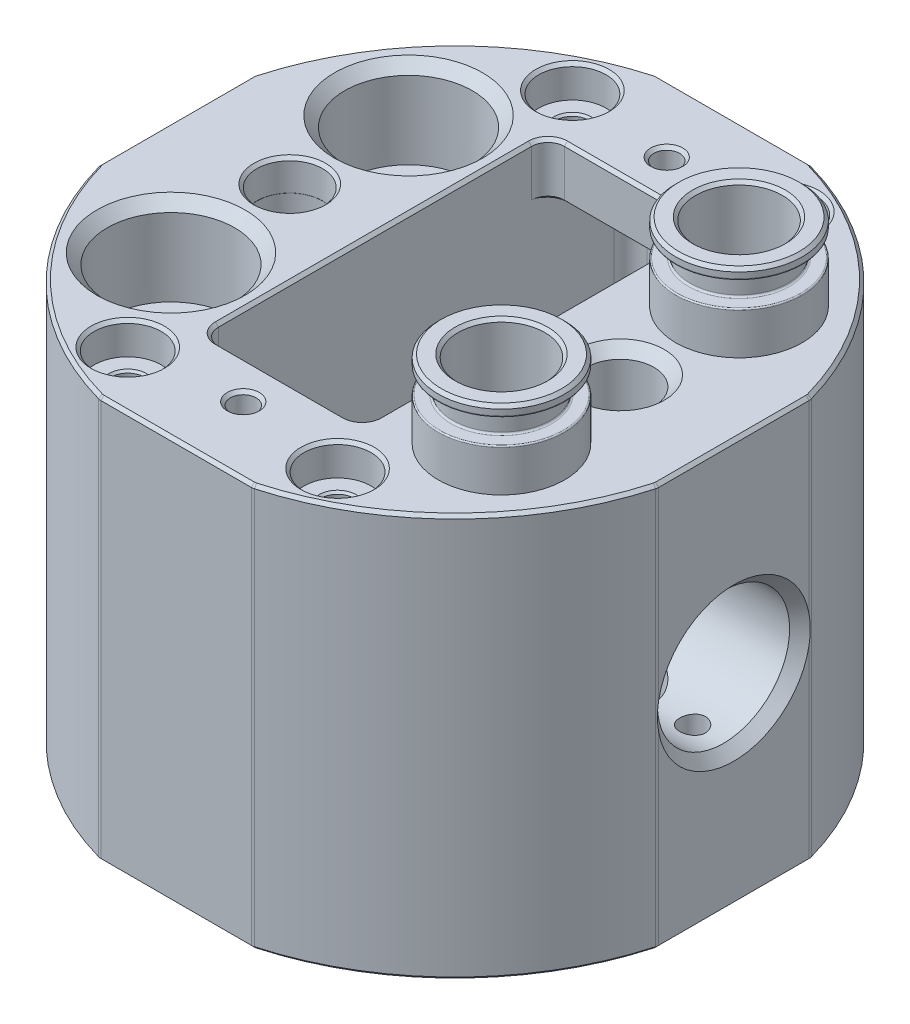
from build123d import *

# Parameters (mm, degrees)
MAIN_FEATURES_R                            = 3.2639
MAIN_FEATURES_R_2                          = 3.16865
BODY_DEPTH                                 = 39
CYLINDER_EDGES_R                           = 1
ELECTRICAL_CUTOUT_DEPTH                    = 33.9
ELECTRICAL_MOUNTING_HOLES_AT_2_COUNT       = 2
ELECTRICAL_MOUNTING_HOLES_AT_2_PITCH       = 41
FLUID_CONNECTOR_SKETCH_W                   = 1.45
FLUID_CONNECTOR_SKETCH_H                   = 8
FLUID_CONNECTOR_SKETCH_W_2                 = 3.225
FLUID_CONNECTOR_SKETCH_H_2                 = 2.15
FLUID_CONNECTOR_SKETCH_W_3                 = 2.6
FLUID_CONNECTOR_SKETCH_H_3                 = 14.5
SCHRADER_RELIEF_SKETCH_R                   = 2.6
SCHRADER_RELIEF_CUT_1_DEPTH                = 13.5
SCHRADER_RELIEF_CUT_2_DEPTH                = 6
O_RING_BORE_CHAMFER_SIZE                   = 1
FLUID_MIRROR_2_COPY_1_SKETCH_W             = 1.45
FLUID_MIRROR_2_COPY_1_SKETCH_H             = 8
FLUID_MIRROR_2_COPY_1_SKETCH_W_2           = 3.225
FLUID_MIRROR_2_COPY_1_SKETCH_H_2           = 2.15
FLUID_MIRROR_2_COPY_1_SKETCH_W_3           = 2.6
FLUID_MIRROR_2_COPY_1_SKETCH_H_3           = 14.5
O_RING_BORE_CHAMFER_OF_FLUID_MIRROR_2_SIZE = 1
LATCH_PIN_SHOULDER_START                   = 36
MAIN_FEATURES_6_R                          = 3.18135
MAIN_FEATURES_6_R_2                        = 3.16865
LATCH_PIN_SHOULDER_DEPTH                   = 3
MOUNTING_HOLES_AT_2_COUNT                  = 2
MOUNTING_HOLES_AT_2_PITCH                  = 20.318917454
MOUNTING_HOLES_AT_3_COUNT                  = 2
MOUNTING_HOLES_AT_3_PITCH                  = 43.058820532
MOUNTING_HOLES_AT_4_COUNT                  = 2
MOUNTING_HOLES_AT_4_PITCH                  = 47.612187853
LATCH_2_SKETCH_7_R                         = 6.4008
RELEASE_BUTTON_BORE_DEPTH                  = 17.75
LATCH_PIN_CHAMFER_SIZE                     = 1
BREAK_EDGES_SIZE                           = 0.3


with BuildPart() as part:
    # main_features → body (new body)
    with BuildSketch(Plane(origin=(0, 0, 0), x_dir=(1, 0, 0), z_dir=(0, 1, 0))):
        with BuildLine():
            Line((-27, 7.416198487), (-27, -7.416198487))
            ThreePointArc((-27, -7.416198487), (-19.798989873, -19.798989873), (-7.416198487, -27))
            Line((-7.416198487, -27), (7.416198487, -27))
            ThreePointArc((7.416198487, -27), (19.798989873, -19.798989873), (27, -7.416198487))
            Line((27, -7.416198487), (27, 7.416198487))
            ThreePointArc((27, 7.416198487), (19.798989873, 19.798989873), (7.416198487, 27))
            Line((7.416198487, 27), (-7.416198487, 27))
            ThreePointArc((-7.416198487, 27), (-19.798989873, 19.798989873), (-27, 7.416198487))
        make_face()
        with BuildLine():
            Line((-6.1625, 16.75), (6.1625, 16.75))
            ThreePointArc((6.1625, 16.75), (7.285032015, 16.285032015), (7.75, 15.1625))
            Line((7.75, 15.1625), (7.75, -15.1625))
            ThreePointArc((7.75, -15.1625), (7.285032015, -16.285032015), (6.1625, -16.75))
            Line((6.1625, -16.75), (-6.1625, -16.75))
            ThreePointArc((-6.1625, -16.75), (-7.285032015, -16.285032015), (-7.75, -15.1625))
            Line((-7.75, -15.1625), (-7.75, 15.1625))
            ThreePointArc((-7.75, 15.1625), (-7.285032015, 16.285032015), (-6.1625, 16.75))
        make_face(mode=Mode.SUBTRACT)
        with Locations(Location((16, 0, 0), (0, 0, 270))):
            Circle(MAIN_FEATURES_R, mode=Mode.SUBTRACT)
        with Locations(Location((-16, 0, 0), (0, 0, 270))):
            Circle(MAIN_FEATURES_R_2, mode=Mode.SUBTRACT)
    extrude(amount=BODY_DEPTH)

    # cylinder_edges
    cylinder_edges_edges = [part.edges().sort_by_distance(p)[0] for p in [
        (-7.416198487, 19.5, 27),
        (-27, 19.5, 7.416198487),
        (-27, 19.5, -7.416198487),
        (-7.416198487, 19.5, -27),
        (7.416198487, 19.5, -27),
        (27, 19.5, -7.416198487),
        (27, 19.5, 7.416198487),
        (7.416198487, 19.5, 27),
    ]]
    fillet(cylinder_edges_edges, radius=CYLINDER_EDGES_R)

    # Sketch1<3> → electrical_cutout (cut)
    with BuildSketch(Plane(origin=(0, 0, 0), x_dir=(1, 0, 0), z_dir=(0, 1, 0))):
        with BuildLine():
            Line((-6.1625, 16.75), (6.1625, 16.75))
            ThreePointArc((6.1625, 16.75), (7.285032015, 16.285032015), (7.75, 15.1625))
            Line((7.75, 15.1625), (7.75, 23.1625))
            ThreePointArc((7.75, 23.1625), (7.285032015, 24.285032015), (6.1625, 24.75))
            Line((6.1625, 24.75), (-6.1625, 24.75))
            ThreePointArc((-6.1625, 24.75), (-7.285032015, 24.285032015), (-7.75, 23.1625))
            Line((-7.75, 23.1625), (-7.75, 15.1625))
            ThreePointArc((-7.75, 15.1625), (-7.285032015, 16.285032015), (-6.1625, 16.75))
        make_face()
        with BuildLine():
            Line((7.75, -23.1625), (7.75, -15.1625))
            ThreePointArc((7.75, -15.1625), (7.285032015, -16.285032015), (6.1625, -16.75))
            Line((6.1625, -16.75), (-6.1625, -16.75))
            ThreePointArc((-6.1625, -16.75), (-7.285032015, -16.285032015), (-7.75, -15.1625))
            Line((-7.75, -15.1625), (-7.75, -23.1625))
            ThreePointArc((-7.75, -23.1625), (-7.285032015, -24.285032015), (-6.1625, -24.75))
            Line((-6.1625, -24.75), (6.1625, -24.75))
            ThreePointArc((6.1625, -24.75), (7.285032015, -24.285032015), (7.75, -23.1625))
        make_face()
    extrude(amount=ELECTRICAL_CUTOUT_DEPTH, mode=Mode.SUBTRACT)

    # Sketch9 → electrical_mounting_holes (revolve, cut)
    with BuildSketch(Plane(origin=(0, 33.9, 20.5), x_dir=(0, 0, -1), z_dir=(1, 0, 0))):
        Polygon((0, 0), (0, 5.1), (1.55, 5.1), (1.25, 4.8), (1.25, 0), align=None)
    electrical_mounting_holes = revolve(axis=Axis((0, 27.55, 20.5), (0, 1, 0)), mode=Mode.SUBTRACT)

    # electrical_mounting_holes at 2: electrical_mounting_holes ×2
    with Locations(*[(0, 0, -i * ELECTRICAL_MOUNTING_HOLES_AT_2_PITCH) for i in range(1, ELECTRICAL_MOUNTING_HOLES_AT_2_COUNT)]):
        add(electrical_mounting_holes, mode=Mode.SUBTRACT)

    # fluid_connector_sketch → fluid_connector_cutout (revolve, cut)
    with BuildSketch(Plane.XY.offset(11.5), mode=Mode.PRIVATE) as fluid_connector_cutout_sk:
        Polygon((10.7, 0), (11.325, 0), (11.325, 8), (10.7, 8), (10.7, 0.3), align=None)
        with Locations((12.05, 4)):
            Rectangle(FLUID_CONNECTOR_SKETCH_W, FLUID_CONNECTOR_SKETCH_H)
        with Locations((14.3875, 4)):
            Rectangle(FLUID_CONNECTOR_SKETCH_W_2, FLUID_CONNECTOR_SKETCH_H)
        with BuildLine():
            Line((11.325, 8), (12.775, 8))
            Line((12.775, 8), (12.775, 10.15))
            Line((12.775, 10.15), (11.426933921, 10.15))
            ThreePointArc((11.426933921, 10.15), (11.352354097, 10.076655003), (11.325, 9.975692674))
            Line((11.325, 9.975692674), (11.325, 8))
        make_face()
        with Locations((14.3875, 9.075)):
            Rectangle(FLUID_CONNECTOR_SKETCH_W_2, FLUID_CONNECTOR_SKETCH_H_2)
        with BuildLine():
            Line((11.426933921, 10.15), (12.775, 10.15))
            Line((12.775, 10.15), (12.775, 10.35))
            Line((12.775, 10.35), (11.497672521, 10.173816899))
            ThreePointArc((11.497672521, 10.173816899), (11.461182312, 10.165237662), (11.426933921, 10.15))
        make_face()
        Polygon((12.775, 10.15), (16, 10.15), (16, 12.5), (13.4, 12.5), (12.875, 12.5), (12.775, 11.5), (12.775, 10.35), align=None)
        with Locations((14.7, 19.75)):
            Rectangle(FLUID_CONNECTOR_SKETCH_W_3, FLUID_CONNECTOR_SKETCH_H_3)
        Polygon((13.4, 27), (16, 27), (16, 35), (12.5, 35), (12.5, 27), align=None)
        Polygon((12.5, 35), (16, 35), (16, 39), (11.8, 39), (11.8, 35), align=None)
        Polygon((10.4, 0), (10.7, 0), (10.7, 0.3), align=None)
    fluid_connector_cutout = revolve(fluid_connector_cutout_sk.sketch.rotate(Axis((16, 0, 11.5), (0, 1, 0)), 270), axis=Axis((16, 0, 11.5), (0, 1, 0)), mode=Mode.SUBTRACT)

    # fluid_connector_sketch<4> → o-ring_boss (revolve)
    with BuildSketch(Plane.XY.offset(11.5), mode=Mode.PRIVATE) as o_ring_boss_sk:
        with BuildLine():
            Line((20.2, 46.5), (20.2, 39))
            Line((20.2, 39), (22.1214, 39))
            Line((22.1214, 39), (22.1214, 42.9854))
            ThreePointArc((22.1214, 42.9854), (22.084202561, 43.075202561), (21.9944, 43.1124))
            Line((21.9944, 43.1124), (20.9022, 43.1124))
            ThreePointArc((20.9022, 43.1124), (20.776476414, 43.164476414), (20.7244, 43.2902))
            Line((20.7244, 43.2902), (20.7244, 45.3222))
            ThreePointArc((20.7244, 45.3222), (20.776476414, 45.447923586), (20.9022, 45.5))
            Line((20.9022, 45.5), (21.9944, 45.5))
            ThreePointArc((21.9944, 45.5), (22.084202561, 45.537197439), (22.1214, 45.627))
            Line((22.1214, 45.627), (22.1214, 46.5))
            Line((22.1214, 46.5), (20.2, 46.5))
        make_face()
        with BuildLine():
            Line((9.8786, 39), (11.8, 39))
            Line((11.8, 39), (11.8, 46.5))
            Line((11.8, 46.5), (9.8786, 46.5))
            Line((9.8786, 46.5), (9.8786, 45.627))
            ThreePointArc((9.8786, 45.627), (9.915797439, 45.537197439), (10.0056, 45.5))
            Line((10.0056, 45.5), (11.0978, 45.5))
            ThreePointArc((11.0978, 45.5), (11.223523586, 45.447923586), (11.2756, 45.3222))
            Line((11.2756, 45.3222), (11.2756, 43.2902))
            ThreePointArc((11.2756, 43.2902), (11.223523586, 43.164476414), (11.0978, 43.1124))
            Line((11.0978, 43.1124), (10.0056, 43.1124))
            ThreePointArc((10.0056, 43.1124), (9.915797439, 43.075202561), (9.8786, 42.9854))
            Line((9.8786, 42.9854), (9.8786, 39))
        make_face()
    o_ring_boss = revolve(o_ring_boss_sk.sketch.rotate(Axis((16, 0, 11.5), (0, 1, 0)), 90), axis=Axis((16, 0, 11.5), (0, 1, 0)))

    # fluid_connector_sketch<6> one side → o-ring_bore (revolve, cut)
    with BuildSketch(Plane.XY.offset(11.5), mode=Mode.PRIVATE) as o_ring_bore_sk:
        Polygon((-19.5, 27.5), (-19.5, 19.5), (-16, 19.5), (-16, 39), (-22.1722, 39), (-22.1722, 30.5), (-20.2, 30.5), (-20.2, 27.5), align=None)
    o_ring_bore = revolve(o_ring_bore_sk.sketch.rotate(Axis((-16, 0, 11.5), (0, 1, 0)), 180), axis=Axis((-16, 0, 11.5), (0, 1, 0)), mode=Mode.SUBTRACT)

    # fluid_mirror_1: fluid_connector_cutout across plane
    add(fluid_connector_cutout.mirror(Plane(origin=(0, 0, 0), x_dir=(0, 0, 1), z_dir=(1, 0, 0))), mode=Mode.SUBTRACT)

    # schrader_relief_sketch → schrader_relief_cut_1 (cut)
    with BuildSketch(Plane.XZ.offset(-12.5)):
        with BuildLine():
            ThreePointArc((18.992702522, 10.600357508), (19.091748727, 11.045340997), (19.125, 11.5))
            ThreePointArc((19.125, 11.5), (19.091748727, 11.954659003), (18.992702522, 12.399642492))
            ThreePointArc((18.992702522, 12.399642492), (18.375189631, 13.325183005), (17.345995177, 13.747919554))
            ThreePointArc((17.345995177, 13.747919554), (17.305320374, 13.760881283), (17.273757807, 13.789625855))
            ThreePointArc((17.273757807, 13.789625855), (16.393059998, 14.469566075), (15.282761992, 14.541577656))
            ThreePointArc((15.282761992, 14.541577656), (14.4375, 14.206329387), (13.724535486, 13.641935164))
            ThreePointArc((13.724535486, 13.641935164), (13.231750336, 12.644383056), (13.380246972, 11.54170624))
            ThreePointArc((13.380246972, 11.54170624), (13.389359187, 11.499999962), (13.380246941, 11.458293691))
            ThreePointArc((13.380246941, 11.458293691), (13.231750342, 10.355616906), (13.724535486, 9.358064836))
            ThreePointArc((13.724535486, 9.358064836), (14.4375, 8.793670613), (15.282761992, 8.458422344))
            ThreePointArc((15.282761992, 8.458422344), (16.393060034, 8.530433939), (17.27375785, 9.210374206))
            ThreePointArc((17.27375785, 9.210374206), (17.305320439, 9.239118754), (17.345995252, 9.252080453))
            ThreePointArc((17.345995252, 9.252080453), (18.37518966, 9.674817019), (18.992702522, 10.600357508))
        make_face()
        with Locations(Location((16, 11.5, 0), (0, 0, 270))):
            Circle(SCHRADER_RELIEF_SKETCH_R, mode=Mode.SUBTRACT)
    schrader_relief_cut_1 = extrude(amount=-SCHRADER_RELIEF_CUT_1_DEPTH, mode=Mode.SUBTRACT)

    # schrader_relief_sketch<4> → schrader_relief_cut_2 (cut)
    with BuildSketch(Plane.XZ.offset(-12.5)):
        with BuildLine():
            ThreePointArc((-15.282761992, 14.541577656), (-16.393059998, 14.469566075), (-17.273757807, 13.789625855))
            ThreePointArc((-17.273757807, 13.789625855), (-17.305320374, 13.760881283), (-17.345995177, 13.747919554))
            ThreePointArc((-17.345995177, 13.747919554), (-18.375189631, 13.325183005), (-18.992702522, 12.399642492))
            ThreePointArc((-18.992702522, 12.399642492), (-19.125, 11.5), (-18.992702522, 10.600357508))
            ThreePointArc((-18.992702522, 10.600357508), (-18.37518966, 9.674817019), (-17.345995252, 9.252080453))
            ThreePointArc((-17.345995252, 9.252080453), (-17.305320439, 9.239118754), (-17.27375785, 9.210374206))
            ThreePointArc((-17.27375785, 9.210374206), (-16.393060034, 8.530433939), (-15.282761992, 8.458422344))
            ThreePointArc((-15.282761992, 8.458422344), (-14.4375, 8.793670613), (-13.724535486, 9.358064836))
            ThreePointArc((-13.724535486, 9.358064836), (-13.231750342, 10.355616906), (-13.380246941, 11.458293691))
            ThreePointArc((-13.380246941, 11.458293691), (-13.389359187, 11.499999962), (-13.380246972, 11.54170624))
            ThreePointArc((-13.380246972, 11.54170624), (-13.231750336, 12.644383056), (-13.724535486, 13.641935164))
            ThreePointArc((-13.724535486, 13.641935164), (-14.4375, 14.206329387), (-15.282761992, 14.541577656))
        make_face()
    schrader_relief_cut_2 = extrude(amount=-SCHRADER_RELIEF_CUT_2_DEPTH, mode=Mode.SUBTRACT)

    # o-ring_bore_chamfer
    o_ring_bore_chamfer_edges = [part.edges().sort_by_distance(p)[0] for p in [
        (-22.1722, 39, 11.5),
    ]]
    chamfer(o_ring_bore_chamfer_edges, length=O_RING_BORE_CHAMFER_SIZE)

    # fluid_mirror_2: fluid_connector_cutout, o-ring_boss, o-ring_bore, schrader_relief_cut_1, schrader_relief_cut_2 across plane
    add(fluid_connector_cutout.mirror(Plane.XY), mode=Mode.SUBTRACT)
    add(o_ring_boss.mirror(Plane.XY))
    add(o_ring_bore.mirror(Plane.XY), mode=Mode.SUBTRACT)
    add(schrader_relief_cut_1.mirror(Plane.XY), mode=Mode.SUBTRACT)
    add(schrader_relief_cut_2.mirror(Plane.XY), mode=Mode.SUBTRACT)

    # fluid_mirror_2 copy 1 sketch → fluid_mirror_2 copy 1 (revolve, cut)
    with BuildSketch(Plane(origin=(0, 0, -11.5), x_dir=(-1, 0, 0), z_dir=(0, 0, -1))):
        Polygon((10.7, 0), (11.325, 0), (11.325, 8), (10.7, 8), (10.7, 0.3), align=None)
        with Locations((12.05, 4)):
            Rectangle(FLUID_MIRROR_2_COPY_1_SKETCH_W, FLUID_MIRROR_2_COPY_1_SKETCH_H)
        with Locations((14.3875, 4)):
            Rectangle(FLUID_MIRROR_2_COPY_1_SKETCH_W_2, FLUID_MIRROR_2_COPY_1_SKETCH_H)
        with BuildLine():
            Line((11.325, 8), (12.775, 8))
            Line((12.775, 8), (12.775, 10.15))
            Line((12.775, 10.15), (11.426933921, 10.15))
            ThreePointArc((11.426933921, 10.15), (11.352354097, 10.076655003), (11.325, 9.975692674))
            Line((11.325, 9.975692674), (11.325, 8))
        make_face()
        with Locations((14.3875, 9.075)):
            Rectangle(FLUID_MIRROR_2_COPY_1_SKETCH_W_2, FLUID_MIRROR_2_COPY_1_SKETCH_H_2)
        with BuildLine():
            Line((11.426933921, 10.15), (12.775, 10.15))
            Line((12.775, 10.15), (12.775, 10.35))
            Line((12.775, 10.35), (11.497672521, 10.173816899))
            ThreePointArc((11.497672521, 10.173816899), (11.461182312, 10.165237662), (11.426933921, 10.15))
        make_face()
        Polygon((12.775, 10.15), (16, 10.15), (16, 12.5), (13.4, 12.5), (12.875, 12.5), (12.775, 11.5), (12.775, 10.35), align=None)
        with Locations((14.7, 19.75)):
            Rectangle(FLUID_MIRROR_2_COPY_1_SKETCH_W_3, FLUID_MIRROR_2_COPY_1_SKETCH_H_3)
        Polygon((13.4, 27), (16, 27), (16, 35), (12.5, 35), (12.5, 27), align=None)
        Polygon((12.5, 35), (16, 35), (16, 39), (11.8, 39), (11.8, 35), align=None)
        Polygon((10.4, 0), (10.7, 0), (10.7, 0.3), align=None)
    revolve(axis=Axis((-16, 0, -11.5), (0, 1, 0)), mode=Mode.SUBTRACT)

    # o-ring_bore_chamfer of fluid_mirror_2
    o_ring_bore_chamfer_of_fluid_mirror_2_edges = [part.edges().sort_by_distance(p)[0] for p in [
        (-22.1722, 39, -11.5),
    ]]
    chamfer(o_ring_bore_chamfer_of_fluid_mirror_2_edges, length=O_RING_BORE_CHAMFER_OF_FLUID_MIRROR_2_SIZE)

    # main_features<6> → latch_pin_shoulder (cut)
    with BuildSketch(Plane(origin=(0, 0, 0), x_dir=(1, 0, 0), z_dir=(0, 1, 0)).offset(LATCH_PIN_SHOULDER_START)):
        with Locations(Location((-16, 0, 0), (0, 0, 270))):
            Circle(MAIN_FEATURES_6_R)
        with Locations(Location((-16, 0, 0), (0, 0, 270))):
            Circle(MAIN_FEATURES_6_R_2, mode=Mode.SUBTRACT)
    extrude(amount=LATCH_PIN_SHOULDER_DEPTH, mode=Mode.SUBTRACT)

    # Sketch11 → mounting_holes (revolve, cut)
    with BuildSketch(Plane(origin=(10.159458727, 39, 21.529410266), x_dir=(0, 0, 1), z_dir=(1, 0, 0))):
        Polygon((0, 0), (0, 39), (1.8, 39), (1.6, 38.8), (1.6, 3.3), (1.8, 3.1), (3.25, 3.1), (3.25, 0), align=None)
    mounting_holes = revolve(axis=Axis((10.159458727, 45.35, 21.529410266), (0, -1, 0)), mode=Mode.SUBTRACT)

    # mounting_holes at 2: mounting_holes ×2
    with Locations(*[(-i * MOUNTING_HOLES_AT_2_PITCH, 0, 0) for i in range(1, MOUNTING_HOLES_AT_2_COUNT)]):
        add(mounting_holes, mode=Mode.SUBTRACT)

    # mounting_holes at 3: mounting_holes ×2
    with Locations(*[(0, 0, -i * MOUNTING_HOLES_AT_3_PITCH) for i in range(1, MOUNTING_HOLES_AT_3_COUNT)]):
        add(mounting_holes, mode=Mode.SUBTRACT)

    # mounting_holes at 4: mounting_holes ×2
    with Locations(*[Vector(-0.4267587433148433, 0, -0.9043655096277919) * (i * MOUNTING_HOLES_AT_4_PITCH) for i in range(1, MOUNTING_HOLES_AT_4_COUNT)]):
        add(mounting_holes, mode=Mode.SUBTRACT)

    # latch_2_sketch<7> → release_button_bore (cut)
    with BuildSketch(Plane(origin=(27, 0, 32), x_dir=(0, 0, 1), z_dir=(-1, 0, 0))):
        with Locations(Location((-32, 19.5, 0), (0, 0, 180))):
            Circle(LATCH_2_SKETCH_7_R)
    extrude(amount=RELEASE_BUTTON_BORE_DEPTH, mode=Mode.SUBTRACT)

    # set_screw_hole: read off the stored shape, not the designer's step
    # set_screw_hole outline → set_screw_hole (revolve, cut)
    with BuildSketch(Plane(origin=(23, 0, 0), x_dir=(1, 0, 0), z_dir=(0, 0, 1))):
        Polygon((1.25, 0.5), (1.25, 13.222509506), (0, 13.222509506), (0, 0), (1.75, 0), align=None)
    revolve(axis=Axis((23, 0, 0), (0, 1, 0)), mode=Mode.SUBTRACT)

    # latch_pin_chamfer
    # the kernel refuses this chamfer: 1 mm, written as the material it takes off along each edge
    with BuildSketch(Plane(origin=(16, 39, 0), x_dir=(0, 0, 1), z_dir=(-1, 0, 0))) as latch_pin_chamfer_piece_1:
        Polygon((3.2639 + LATCH_PIN_CHAMFER_SIZE, 0), (3.2639, -LATCH_PIN_CHAMFER_SIZE), (3.2639, 0), align=None)
    revolve(axis=Axis((16, 39, 0), (0, 1, 0)), mode=Mode.SUBTRACT)
    with BuildSketch(Plane(origin=(27, 19.5, 0), x_dir=(0, 0, -1), z_dir=(0, 1, 0))) as latch_pin_chamfer_piece_2:
        Polygon((6.4008 + LATCH_PIN_CHAMFER_SIZE, 0), (6.4008, LATCH_PIN_CHAMFER_SIZE), (6.4008, 0), align=None)
    revolve(axis=Axis((27, 19.5, 0), (-1, 0, 0)), mode=Mode.SUBTRACT)

    # break_edges
    # the kernel refuses this chamfer: 0.3 mm, written as the material it takes off along each edge
    with BuildSketch(Plane(origin=(7.75, 39, -15.1625), x_dir=(1, 0, 0), z_dir=(0, 0, 1)), Plane(origin=(-7.75, 39, 15.1625), x_dir=(-1, 0, 0), z_dir=(0, 0, -1))) as break_edges_piece_1:
        Polygon((BREAK_EDGES_SIZE, 0), (0, -BREAK_EDGES_SIZE), (0, 0), align=None)
    extrude(amount=30.325, mode=Mode.SUBTRACT)
    with BuildSketch(Plane(origin=(6.1625, 33.9, -15.1625), x_dir=(0, 0, -1), z_dir=(-1, 0, 0))) as break_edges_piece_2_section:
        Polygon((1.5875, -BREAK_EDGES_SIZE), (1.5875 + BREAK_EDGES_SIZE, 0), (1.5875, 0), align=None)
    break_edges_piece_2 = revolve(axis=Axis((6.1625, 33.9, -15.1625), (0, -1, 0)), revolution_arc=137.355555028, mode=Mode.PRIVATE)
    break_edges_piece_2 = split(break_edges_piece_2, bisect_by=Plane(origin=(7.75, 33.9, -15.1625), z_dir=(-1, 0, 0)), keep=Keep.TOP, mode=Mode.PRIVATE)
    add(break_edges_piece_2, mode=Mode.SUBTRACT)
    with BuildSketch(Plane(origin=(6.1625, 0, -24.75), x_dir=(0, 0, -1), z_dir=(-1, 0, 0)), Plane(origin=(-6.1625, 33.9, -16.75), x_dir=(0, 1, 0), z_dir=(1, 0, 0)), Plane(origin=(-6.1625, 0, 24.75), x_dir=(0, 0, 1), z_dir=(1, 0, 0)), Plane(origin=(6.1625, 33.9, 16.75), x_dir=(0, 1, 0), z_dir=(-1, 0, 0)), Plane(origin=(6.1625, 39, 16.75), x_dir=(0, 0, 1), z_dir=(-1, 0, 0)), Plane(origin=(-6.1625, 39, -16.75), x_dir=(0, 0, -1), z_dir=(1, 0, 0))) as break_edges_piece_3:
        Polygon((BREAK_EDGES_SIZE, 0), (0, -BREAK_EDGES_SIZE), (0, 0), align=None)
    extrude(amount=12.325, mode=Mode.SUBTRACT)
    with BuildSketch(Plane(origin=(6.1625, 0, -23.1625), x_dir=(1, 0, 0), z_dir=(0, 0, 1))) as break_edges_piece_4:
        Polygon((1.5875 + BREAK_EDGES_SIZE, 0), (1.5875, BREAK_EDGES_SIZE), (1.5875, 0), align=None)
    revolve(axis=Axis((6.1625, 0, -23.1625), (0, 1, 0)), revolution_arc=90, mode=Mode.SUBTRACT)
    with BuildSketch(Plane(origin=(-6.1625, 33.9, -15.1625), x_dir=(-0.6774467646526394, 0, 0.7355718055102924), z_dir=(0.7355718055102924, 0, 0.6774467646526394))) as break_edges_piece_5_section:
        Polygon((1.5875, -BREAK_EDGES_SIZE), (1.5875 + BREAK_EDGES_SIZE, 0), (1.5875, 0), align=None)
    break_edges_piece_5 = revolve(axis=Axis((-6.1625, 33.9, -15.1625), (0, -1, 0)), revolution_arc=137.355555028, mode=Mode.PRIVATE)
    break_edges_piece_5 = split(break_edges_piece_5, bisect_by=Plane(origin=(-7.75, 33.9, -15.1625), z_dir=(1, 0, 0)), keep=Keep.TOP, mode=Mode.PRIVATE)
    add(break_edges_piece_5, mode=Mode.SUBTRACT)
    with BuildSketch(Plane(origin=(-6.1625, 0, -23.1625), x_dir=(0, 0, -1), z_dir=(1, 0, 0))) as break_edges_piece_6:
        Polygon((1.5875 + BREAK_EDGES_SIZE, 0), (1.5875, BREAK_EDGES_SIZE), (1.5875, 0), align=None)
    revolve(axis=Axis((-6.1625, 0, -23.1625), (0, 1, 0)), revolution_arc=90, mode=Mode.SUBTRACT)
    with BuildSketch(Plane(origin=(6.1625, 0, 23.1625), x_dir=(0, 0, 1), z_dir=(-1, 0, 0))) as break_edges_piece_7:
        Polygon((1.5875 + BREAK_EDGES_SIZE, 0), (1.5875, BREAK_EDGES_SIZE), (1.5875, 0), align=None)
    revolve(axis=Axis((6.1625, 0, 23.1625), (0, 1, 0)), revolution_arc=90, mode=Mode.SUBTRACT)
    with BuildSketch(Plane(origin=(-6.1625, 0, 23.1625), x_dir=(-1, 0, 0), z_dir=(0, 0, -1))) as break_edges_piece_8:
        Polygon((1.5875 + BREAK_EDGES_SIZE, 0), (1.5875, BREAK_EDGES_SIZE), (1.5875, 0), align=None)
    revolve(axis=Axis((-6.1625, 0, 23.1625), (0, 1, 0)), revolution_arc=90, mode=Mode.SUBTRACT)
    with BuildSketch(Plane(origin=(6.1625, 33.9, 15.1625), x_dir=(0.6774467646526388, 0, -0.7355718055102929), z_dir=(-0.7355718055102929, 0, -0.6774467646526388))) as break_edges_piece_9_section:
        Polygon((1.5875, -BREAK_EDGES_SIZE), (1.5875 + BREAK_EDGES_SIZE, 0), (1.5875, 0), align=None)
    break_edges_piece_9 = revolve(axis=Axis((6.1625, 33.9, 15.1625), (0, -1, 0)), revolution_arc=137.355555028, mode=Mode.PRIVATE)
    break_edges_piece_9 = split(break_edges_piece_9, bisect_by=Plane(origin=(7.75, 33.9, 15.1625), z_dir=(-1, 0, 0)), keep=Keep.TOP, mode=Mode.PRIVATE)
    add(break_edges_piece_9, mode=Mode.SUBTRACT)
    with BuildSketch(Plane(origin=(-6.1625, 33.9, 15.1625), x_dir=(0, 0, 1), z_dir=(1, 0, 0))) as break_edges_piece_10_section:
        Polygon((1.5875, -BREAK_EDGES_SIZE), (1.5875 + BREAK_EDGES_SIZE, 0), (1.5875, 0), align=None)
    break_edges_piece_10 = revolve(axis=Axis((-6.1625, 33.9, 15.1625), (0, -1, 0)), revolution_arc=137.355555028, mode=Mode.PRIVATE)
    break_edges_piece_10 = split(break_edges_piece_10, bisect_by=Plane(origin=(-7.75, 33.9, 15.1625), z_dir=(1, 0, 0)), keep=Keep.TOP, mode=Mode.PRIVATE)
    add(break_edges_piece_10, mode=Mode.SUBTRACT)
    with BuildSketch(Plane(origin=(6.1625, 39, 15.1625), x_dir=(1, 0, 0), z_dir=(0, 0, -1))) as break_edges_piece_11:
        Polygon((1.5875 + BREAK_EDGES_SIZE, 0), (1.5875, BREAK_EDGES_SIZE), (1.5875, 0), align=None)
    revolve(axis=Axis((6.1625, 39, 15.1625), (0, -1, 0)), revolution_arc=90, mode=Mode.SUBTRACT)
    with BuildSketch(Plane(origin=(-16, 0, 0), x_dir=(0, 0, 1), z_dir=(-1, 0, 0))) as break_edges_piece_12:
        Polygon((3.16865 + BREAK_EDGES_SIZE, 0), (3.16865, BREAK_EDGES_SIZE), (3.16865, 0), align=None)
    revolve(axis=Axis((-16, 0, 0), (0, 1, 0)), mode=Mode.SUBTRACT)
    with BuildSketch(Plane(origin=(16, 46.5, 11.5), x_dir=(0, 0, -1), z_dir=(1, 0, 0))) as break_edges_piece_13:
        Polygon((4.2 + BREAK_EDGES_SIZE, 0), (4.2, -BREAK_EDGES_SIZE), (4.2, 0), align=None)
    revolve(axis=Axis((16, 46.5, 11.5), (0, 1, 0)), mode=Mode.SUBTRACT)
    with BuildSketch(Plane(origin=(16, 46.5, 11.5), x_dir=(0, 0, -1), z_dir=(1, 0, 0))) as break_edges_piece_14:
        Polygon((6.1214, -BREAK_EDGES_SIZE), (6.1214 - BREAK_EDGES_SIZE, 0), (6.1214, 0), align=None)
    revolve(axis=Axis((16, 46.5, 11.5), (0, 1, 0)), mode=Mode.SUBTRACT)
    with BuildSketch(Plane(origin=(16, 0, 0), x_dir=(0, 0, 1), z_dir=(-1, 0, 0))) as break_edges_piece_15:
        Polygon((3.2639 + BREAK_EDGES_SIZE, 0), (3.2639, BREAK_EDGES_SIZE), (3.2639, 0), align=None)
    revolve(axis=Axis((16, 0, 0), (0, 1, 0)), mode=Mode.SUBTRACT)
    with BuildSketch(Plane(origin=(-6.1625, 39, 15.1625), x_dir=(0, 0, 1), z_dir=(1, 0, 0))) as break_edges_piece_16:
        Polygon((1.5875 + BREAK_EDGES_SIZE, 0), (1.5875, BREAK_EDGES_SIZE), (1.5875, 0), align=None)
    revolve(axis=Axis((-6.1625, 39, 15.1625), (0, -1, 0)), revolution_arc=90, mode=Mode.SUBTRACT)
    with BuildSketch(Plane(origin=(-7.75, 0, -23.1625), x_dir=(0, 1, 0), z_dir=(0, 0, 1)), Plane(origin=(7.75, 0, 23.1625), x_dir=(0, 1, 0), z_dir=(0, 0, -1))) as break_edges_piece_17:
        Polygon((BREAK_EDGES_SIZE, 0), (0, BREAK_EDGES_SIZE), (0, 0), align=None)
    extrude(amount=46.325, mode=Mode.SUBTRACT)
    with BuildSketch(Plane(origin=(16, 46.5, -11.5), x_dir=(0, 0, 1), z_dir=(1, 0, 0))) as break_edges_piece_18:
        Polygon((4.2 + BREAK_EDGES_SIZE, 0), (4.2, BREAK_EDGES_SIZE), (4.2, 0), align=None)
    revolve(axis=Axis((16, 46.5, -11.5), (0, -1, 0)), mode=Mode.SUBTRACT)
    with BuildSketch(Plane(origin=(16, 46.5, -11.5), x_dir=(0, 0, 1), z_dir=(1, 0, 0))) as break_edges_piece_19:
        Polygon((6.1214, BREAK_EDGES_SIZE), (6.1214 - BREAK_EDGES_SIZE, 0), (6.1214, 0), align=None)
    revolve(axis=Axis((16, 46.5, -11.5), (0, -1, 0)), mode=Mode.SUBTRACT)
    with BuildSketch(Plane(origin=(-6.1625, 39, -15.1625), x_dir=(-1, 0, 0), z_dir=(0, 0, 1))) as break_edges_piece_20:
        Polygon((1.5875 + BREAK_EDGES_SIZE, 0), (1.5875, BREAK_EDGES_SIZE), (1.5875, 0), align=None)
    revolve(axis=Axis((-6.1625, 39, -15.1625), (0, -1, 0)), revolution_arc=90, mode=Mode.SUBTRACT)
    with BuildSketch(Plane(origin=(-16, 39, 0), x_dir=(0, 0, 1), z_dir=(-1, 0, 0))) as break_edges_piece_21:
        Polygon((3.18135 + BREAK_EDGES_SIZE, 0), (3.18135, -BREAK_EDGES_SIZE), (3.18135, 0), align=None)
    revolve(axis=Axis((-16, 39, 0), (0, 1, 0)), mode=Mode.SUBTRACT)
    with BuildSketch(Plane(origin=(-10.159458727, 39, -21.529410266), x_dir=(0, 0, 1), z_dir=(1, 0, 0))) as break_edges_piece_22:
        Polygon((3.25 + BREAK_EDGES_SIZE, 0), (3.25, BREAK_EDGES_SIZE), (3.25, 0), align=None)
    revolve(axis=Axis((-10.159458727, 39, -21.529410266), (0, -1, 0)), mode=Mode.SUBTRACT)
    with BuildSketch(Plane(origin=(10.159458727, 39, -21.529410266), x_dir=(0, 0, 1), z_dir=(1, 0, 0))) as break_edges_piece_23:
        Polygon((3.25 + BREAK_EDGES_SIZE, 0), (3.25, BREAK_EDGES_SIZE), (3.25, 0), align=None)
    revolve(axis=Axis((10.159458727, 39, -21.529410266), (0, -1, 0)), mode=Mode.SUBTRACT)
    with BuildSketch(Plane(origin=(-10.159458727, 39, 21.529410266), x_dir=(0, 0, 1), z_dir=(1, 0, 0))) as break_edges_piece_24:
        Polygon((3.25 + BREAK_EDGES_SIZE, 0), (3.25, BREAK_EDGES_SIZE), (3.25, 0), align=None)
    revolve(axis=Axis((-10.159458727, 39, 21.529410266), (0, -1, 0)), mode=Mode.SUBTRACT)
    with BuildSketch(Plane(origin=(10.159458727, 39, 21.529410266), x_dir=(0, 0, 1), z_dir=(1, 0, 0))) as break_edges_piece_25:
        Polygon((3.25 + BREAK_EDGES_SIZE, 0), (3.25, BREAK_EDGES_SIZE), (3.25, 0), align=None)
    revolve(axis=Axis((10.159458727, 39, 21.529410266), (0, -1, 0)), mode=Mode.SUBTRACT)
    with BuildSketch(Plane(origin=(7.280109889, 0, -27), x_dir=(0, 1, 0), z_dir=(-1, 0, 0)), Plane(origin=(7.280109889, 39, -27), x_dir=(0, 0, 1), z_dir=(-1, 0, 0)), Plane(origin=(-7.280109889, 0, 27), x_dir=(0, 1, 0), z_dir=(1, 0, 0)), Plane(origin=(-27, 0, -7.280109889), x_dir=(0, 1, 0), z_dir=(0, 0, 1)), Plane(origin=(-7.280109889, 39, 27), x_dir=(0, 0, -1), z_dir=(1, 0, 0)), Plane(origin=(27, 39, 7.280109889), x_dir=(-1, 0, 0), z_dir=(0, 0, -1)), Plane(origin=(-27, 39, -7.280109889), x_dir=(1, 0, 0), z_dir=(0, 0, 1))) as break_edges_piece_26:
        Polygon((BREAK_EDGES_SIZE, 0), (0, -BREAK_EDGES_SIZE), (0, 0), align=None)
    extrude(amount=14.560219779, mode=Mode.SUBTRACT)
    with BuildSketch(Plane(origin=(0, 0, 0), x_dir=(-0.962962962962963, 0, 0.269633699602982), z_dir=(-0.269633699602982, 0, -0.962962962962963))) as break_edges_piece_27:
        Polygon((28, BREAK_EDGES_SIZE), (28 - BREAK_EDGES_SIZE, 0), (28, 0), align=None)
    revolve(axis=Axis((0, 0, 0), (0, 1, 0)), revolution_arc=58.715057974, mode=Mode.SUBTRACT)
    with BuildSketch(Plane(origin=(0, 0, 0), x_dir=(-0.26963369960298345, 0, -0.9629629629629626), z_dir=(0.9629629629629626, 0, -0.26963369960298345))) as break_edges_piece_28:
        Polygon((28, BREAK_EDGES_SIZE), (28 - BREAK_EDGES_SIZE, 0), (28, 0), align=None)
    revolve(axis=Axis((0, 0, 0), (0, 1, 0)), revolution_arc=58.715057974, mode=Mode.SUBTRACT)
    with BuildSketch(Plane(origin=(0, 0, 0), x_dir=(0.9629629629629629, 0, -0.2696336996029821), z_dir=(0.2696336996029821, 0, 0.9629629629629629))) as break_edges_piece_29:
        Polygon((28, BREAK_EDGES_SIZE), (28 - BREAK_EDGES_SIZE, 0), (28, 0), align=None)
    revolve(axis=Axis((0, 0, 0), (0, 1, 0)), revolution_arc=58.715057974, mode=Mode.SUBTRACT)
    with BuildSketch(Plane(origin=(27, 0, 7.280109889), x_dir=(-1, 0, 0), z_dir=(0, 0, -1))) as break_edges_piece_30:
        Polygon((BREAK_EDGES_SIZE, 0), (0, BREAK_EDGES_SIZE), (0, 0), align=None)
    extrude(amount=14.560219779, mode=Mode.SUBTRACT)
    with BuildSketch(Plane(origin=(0, 0, 0), x_dir=(0.2696336996029826, 0, 0.9629629629629628), z_dir=(-0.9629629629629628, 0, 0.2696336996029826))) as break_edges_piece_31:
        Polygon((28, BREAK_EDGES_SIZE), (28 - BREAK_EDGES_SIZE, 0), (28, 0), align=None)
    revolve(axis=Axis((0, 0, 0), (0, 1, 0)), revolution_arc=58.715057974, mode=Mode.SUBTRACT)
    with BuildSketch(Plane(origin=(-26, 0, 7.280109889), x_dir=(-1, 0, 0), z_dir=(0, 0, -1))) as break_edges_piece_32:
        Polygon((1, BREAK_EDGES_SIZE), (1 - BREAK_EDGES_SIZE, 0), (1, 0), align=None)
    revolve(axis=Axis((-26, 0, 7.280109889), (0, 1, 0)), revolution_arc=15.642471013, mode=Mode.SUBTRACT)
    with BuildSketch(Plane(origin=(-26, 0, -7.280109889), x_dir=(-1, 0, 0), z_dir=(0, 0, 1))) as break_edges_piece_33:
        Polygon((1, -BREAK_EDGES_SIZE), (1 - BREAK_EDGES_SIZE, 0), (1, 0), align=None)
    revolve(axis=Axis((-26, 0, -7.280109889), (0, -1, 0)), revolution_arc=15.642471013, mode=Mode.SUBTRACT)
    with BuildSketch(Plane(origin=(26, 0, -7.280109889), x_dir=(1, 0, 0), z_dir=(0, 0, 1))) as break_edges_piece_34:
        Polygon((1, BREAK_EDGES_SIZE), (1 - BREAK_EDGES_SIZE, 0), (1, 0), align=None)
    revolve(axis=Axis((26, 0, -7.280109889), (0, 1, 0)), revolution_arc=15.642471013, mode=Mode.SUBTRACT)
    with BuildSketch(Plane(origin=(26, 0, 7.280109889), x_dir=(0.9629629629629627, 0, 0.26963369960298356), z_dir=(-0.26963369960298356, 0, 0.9629629629629627))) as break_edges_piece_35:
        Polygon((1, BREAK_EDGES_SIZE), (1 - BREAK_EDGES_SIZE, 0), (1, 0), align=None)
    revolve(axis=Axis((26, 0, 7.280109889), (0, 1, 0)), revolution_arc=15.642471013, mode=Mode.SUBTRACT)
    with BuildSketch(Plane(origin=(-7.280109889, 0, 26), x_dir=(-0.26963369960297845, 0, 0.962962962962964), z_dir=(-0.962962962962964, 0, -0.26963369960297845))) as break_edges_piece_36:
        Polygon((1, BREAK_EDGES_SIZE), (1 - BREAK_EDGES_SIZE, 0), (1, 0), align=None)
    revolve(axis=Axis((-7.280109889, 0, 26), (0, 1, 0)), revolution_arc=15.642471013, mode=Mode.SUBTRACT)
    with BuildSketch(Plane(origin=(7.280109889, 0, 26), x_dir=(0, 0, 1), z_dir=(-1, 0, 0))) as break_edges_piece_37:
        Polygon((1, BREAK_EDGES_SIZE), (1 - BREAK_EDGES_SIZE, 0), (1, 0), align=None)
    revolve(axis=Axis((7.280109889, 0, 26), (0, 1, 0)), revolution_arc=15.642471013, mode=Mode.SUBTRACT)
    with BuildSketch(Plane(origin=(-7.280109889, 0, -26), x_dir=(0, 0, -1), z_dir=(1, 0, 0))) as break_edges_piece_38:
        Polygon((1, BREAK_EDGES_SIZE), (1 - BREAK_EDGES_SIZE, 0), (1, 0), align=None)
    revolve(axis=Axis((-7.280109889, 0, -26), (0, 1, 0)), revolution_arc=15.642471013, mode=Mode.SUBTRACT)
    with BuildSketch(Plane(origin=(7.280109889, 0, -26), x_dir=(0.26963369960298356, 0, -0.9629629629629627), z_dir=(0.9629629629629627, 0, 0.26963369960298356))) as break_edges_piece_39:
        Polygon((1, BREAK_EDGES_SIZE), (1 - BREAK_EDGES_SIZE, 0), (1, 0), align=None)
    revolve(axis=Axis((7.280109889, 0, -26), (0, 1, 0)), revolution_arc=15.642471013, mode=Mode.SUBTRACT)
    with BuildSketch(Plane(origin=(0, 39, 0), x_dir=(0.9629629629629629, 0, -0.2696336996029821), z_dir=(0.2696336996029821, 0, 0.9629629629629629))) as break_edges_piece_40:
        Polygon((28 - BREAK_EDGES_SIZE, 0), (28, -BREAK_EDGES_SIZE), (28, 0), align=None)
    revolve(axis=Axis((0, 39, 0), (0, 1, 0)), revolution_arc=58.715057974, mode=Mode.SUBTRACT)
    with BuildSketch(Plane(origin=(0, 39, 0), x_dir=(0.2696336996029826, 0, 0.9629629629629628), z_dir=(-0.9629629629629628, 0, 0.2696336996029826))) as break_edges_piece_41:
        Polygon((28 - BREAK_EDGES_SIZE, 0), (28, -BREAK_EDGES_SIZE), (28, 0), align=None)
    revolve(axis=Axis((0, 39, 0), (0, 1, 0)), revolution_arc=58.715057974, mode=Mode.SUBTRACT)
    with BuildSketch(Plane(origin=(6.1625, 39, -15.1625), x_dir=(0, 0, -1), z_dir=(-1, 0, 0))) as break_edges_piece_42:
        Polygon((1.5875 + BREAK_EDGES_SIZE, 0), (1.5875, BREAK_EDGES_SIZE), (1.5875, 0), align=None)
    revolve(axis=Axis((6.1625, 39, -15.1625), (0, -1, 0)), revolution_arc=90, mode=Mode.SUBTRACT)
    with BuildSketch(Plane(origin=(0, 39, 0), x_dir=(-0.26963369960298345, 0, -0.9629629629629626), z_dir=(0.9629629629629626, 0, -0.26963369960298345))) as break_edges_piece_43:
        Polygon((28 - BREAK_EDGES_SIZE, 0), (28, -BREAK_EDGES_SIZE), (28, 0), align=None)
    revolve(axis=Axis((0, 39, 0), (0, 1, 0)), revolution_arc=58.715057974, mode=Mode.SUBTRACT)
    with BuildSketch(Plane(origin=(0, 39, 0), x_dir=(-0.962962962962963, 0, 0.269633699602982), z_dir=(-0.269633699602982, 0, -0.962962962962963))) as break_edges_piece_44:
        Polygon((28 - BREAK_EDGES_SIZE, 0), (28, -BREAK_EDGES_SIZE), (28, 0), align=None)
    revolve(axis=Axis((0, 39, 0), (0, 1, 0)), revolution_arc=58.715057974, mode=Mode.SUBTRACT)
    with BuildSketch(Plane(origin=(-26, 39, 7.280109889), x_dir=(-1, 0, 0), z_dir=(0, 0, -1))) as break_edges_piece_45:
        Polygon((1 - BREAK_EDGES_SIZE, 0), (1, -BREAK_EDGES_SIZE), (1, 0), align=None)
    revolve(axis=Axis((-26, 39, 7.280109889), (0, 1, 0)), revolution_arc=15.642471013, mode=Mode.SUBTRACT)
    with BuildSketch(Plane(origin=(-26, 39, -7.280109889), x_dir=(-1, 0, 0), z_dir=(0, 0, 1))) as break_edges_piece_46:
        Polygon((1 - BREAK_EDGES_SIZE, 0), (1, BREAK_EDGES_SIZE), (1, 0), align=None)
    revolve(axis=Axis((-26, 39, -7.280109889), (0, -1, 0)), revolution_arc=15.642471013, mode=Mode.SUBTRACT)
    with BuildSketch(Plane(origin=(26, 39, -7.280109889), x_dir=(1, 0, 0), z_dir=(0, 0, 1))) as break_edges_piece_47:
        Polygon((1 - BREAK_EDGES_SIZE, 0), (1, -BREAK_EDGES_SIZE), (1, 0), align=None)
    revolve(axis=Axis((26, 39, -7.280109889), (0, 1, 0)), revolution_arc=15.642471013, mode=Mode.SUBTRACT)
    with BuildSketch(Plane(origin=(26, 39, 7.280109889), x_dir=(0.9629629629629627, 0, 0.26963369960298356), z_dir=(-0.26963369960298356, 0, 0.9629629629629627))) as break_edges_piece_48:
        Polygon((1 - BREAK_EDGES_SIZE, 0), (1, -BREAK_EDGES_SIZE), (1, 0), align=None)
    revolve(axis=Axis((26, 39, 7.280109889), (0, 1, 0)), revolution_arc=15.642471013, mode=Mode.SUBTRACT)
    with BuildSketch(Plane(origin=(-7.280109889, 39, 26), x_dir=(-0.26963369960297845, 0, 0.962962962962964), z_dir=(-0.962962962962964, 0, -0.26963369960297845))) as break_edges_piece_49:
        Polygon((1 - BREAK_EDGES_SIZE, 0), (1, -BREAK_EDGES_SIZE), (1, 0), align=None)
    revolve(axis=Axis((-7.280109889, 39, 26), (0, 1, 0)), revolution_arc=15.642471013, mode=Mode.SUBTRACT)
    with BuildSketch(Plane(origin=(7.280109889, 39, 26), x_dir=(0, 0, 1), z_dir=(-1, 0, 0))) as break_edges_piece_50:
        Polygon((1 - BREAK_EDGES_SIZE, 0), (1, -BREAK_EDGES_SIZE), (1, 0), align=None)
    revolve(axis=Axis((7.280109889, 39, 26), (0, 1, 0)), revolution_arc=15.642471013, mode=Mode.SUBTRACT)
    with BuildSketch(Plane(origin=(-7.280109889, 39, -26), x_dir=(0, 0, -1), z_dir=(1, 0, 0))) as break_edges_piece_51:
        Polygon((1 - BREAK_EDGES_SIZE, 0), (1, -BREAK_EDGES_SIZE), (1, 0), align=None)
    revolve(axis=Axis((-7.280109889, 39, -26), (0, 1, 0)), revolution_arc=15.642471013, mode=Mode.SUBTRACT)
    with BuildSketch(Plane(origin=(7.280109889, 39, -26), x_dir=(0.26963369960298356, 0, -0.9629629629629627), z_dir=(0.9629629629629627, 0, 0.26963369960298356))) as break_edges_piece_52:
        Polygon((1 - BREAK_EDGES_SIZE, 0), (1, -BREAK_EDGES_SIZE), (1, 0), align=None)
    revolve(axis=Axis((7.280109889, 39, -26), (0, 1, 0)), revolution_arc=15.642471013, mode=Mode.SUBTRACT)


solid = part.part
